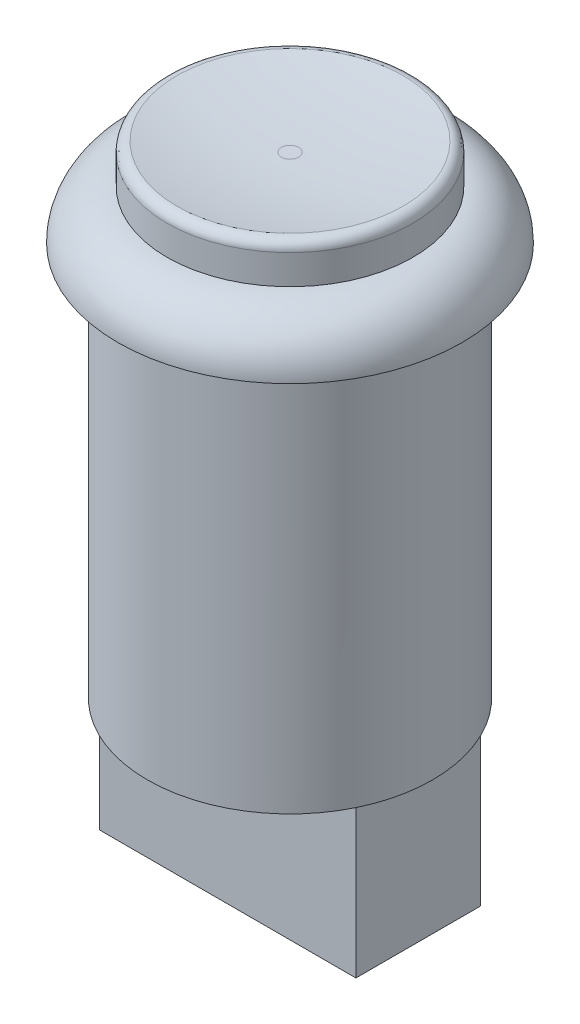
from build123d import *

# Parameters (mm, degrees)
SKETCH1_R           = 17.5
BOSS_EXTRUDE1_DEPTH = 5
FILLET1_R           = 5
SKETCH2_R           = 12.5
BOSS_EXTRUDE2_DEPTH = 4
FILLET2_R           = 1
SKETCH3_R           = 11.5
CUT_EXTRUDE1_DEPTH  = 1
FILLET5_R           = 57
SKETCH5_R           = 14.5
BOSS_EXTRUDE3_DEPTH = 40
SKETCH6_W           = 26.081932022
SKETCH6_H           = 12.67804488
BOSS_EXTRUDE4_DEPTH = 15


# Some blends are built 0.0001 mm under size
with BuildPart() as part:
    # Sketch1 → Boss-Extrude1 (new body)
    with BuildSketch(Plane(origin=(0, 0, 0), x_dir=(1, 0, 0), z_dir=(0, 1, 0))):
        with Locations(Location((0, 0, 0), (0, 0, 270))):
            Circle(SKETCH1_R)
    extrude(amount=BOSS_EXTRUDE1_DEPTH)

    # Fillet1
    fillet1_edges = [part.edges().sort_by_distance(p)[0] for p in [
        (0, 5, -17.5),
    ]]
    fillet(fillet1_edges, radius=FILLET1_R - 0.0001)  # a hair under: the kernel refuses the full size

    # Sketch2 → Boss-Extrude2 (add)
    with BuildSketch(Plane(origin=(0, 5, 0), x_dir=(1, 0, 0), z_dir=(0, 1, 0))):
        with Locations(Location((0, 0, 0), (0, 0, 270))):
            Circle(SKETCH2_R)
    extrude(amount=BOSS_EXTRUDE2_DEPTH)

    # Fillet2
    fillet2_edges = [part.edges().sort_by_distance(p)[0] for p in [
        (0, 9, -12.5),
    ]]
    fillet(fillet2_edges, radius=FILLET2_R)

    # Sketch3 → Cut-Extrude1 (cut)
    with BuildSketch(Plane(origin=(0, 9, 0), x_dir=(1, 0, 0), z_dir=(0, 1, 0))):
        with Locations(Location((0, 0, 0), (0, 0, 270))):
            Circle(SKETCH3_R)
    extrude(amount=-CUT_EXTRUDE1_DEPTH, mode=Mode.SUBTRACT)

    # Fillet5
    # the kernel refuses this fillet: 57 mm, written as the material it adds along each edge
    with BuildSketch(Plane(origin=(0, 8, 0), x_dir=(0, 0, 1), z_dir=(-1, 0, 0))) as fillet5_piece_1:
        with BuildLine():
            CenterArc((0.869854187, 57), FILLET5_R, 270, 10.748235858)
            Line((0.869854187, 0), (11.5, 0))
            Line((11.5, 0), (11.5, 1))
        make_face()
    revolve(axis=Axis((0, 8, 0), (0, 1, 0)))

    # Sketch5 → Boss-Extrude3 (add)
    with BuildSketch(Plane.XZ):
        with Locations(Location((0, 0, 0), (0, 0, 90))):
            Circle(SKETCH5_R)
    extrude(amount=BOSS_EXTRUDE3_DEPTH)

    # Sketch6 → Boss-Extrude4 (add)
    with BuildSketch(Plane.XZ.offset(40)):
        Rectangle(SKETCH6_W, SKETCH6_H)
    extrude(amount=BOSS_EXTRUDE4_DEPTH)


solid = part.part
